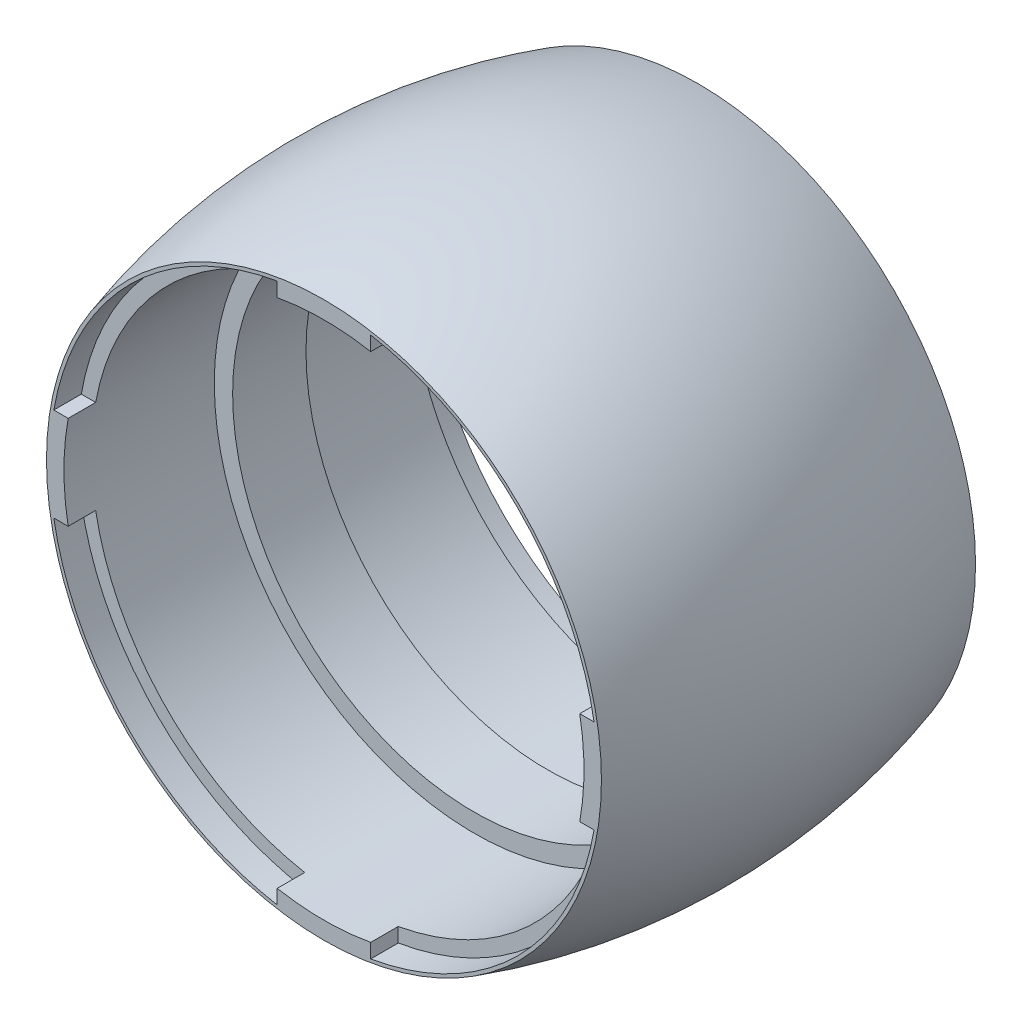
from build123d import *

# Parameters (mm, degrees)
CUT_EXTRUDE1_DEPTH = 3.81
CIRPATTERN1_COUNT  = 2


with BuildPart() as part:
    # Sketch19 → Revolve3 (revolve)
    with BuildSketch(Plane(origin=(0, 0, 0), x_dir=(0, 0, -1), z_dir=(1, 0, 0))):
        with BuildLine():
            ThreePointArc((25.908, 38.433959724), (0, 42.292878264), (-25.908, 38.433959724))
            Line((-25.908, 38.433959724), (-25.908, 36.0172))
            Line((-25.908, 36.0172), (-5.08, 36.0172))
            Line((-5.08, 36.0172), (-5.08, 33.4772))
            Line((-5.08, 33.4772), (5.08, 33.4772))
            Line((5.08, 33.4772), (5.08, 36.0172))
            Line((5.08, 36.0172), (25.908, 36.0172))
            Line((25.908, 36.0172), (25.908, 38.433959724))
        make_face()
    revolve(axis=Axis((0, 0, 51.219231473), (0, 0, -1)))

    # Sketch22 → Cut-Extrude1 (cut)
    with BuildSketch(Plane(origin=(0, 0, -25.908), x_dir=(-1, 0, 0), z_dir=(0, 0, -1))):
        with BuildLine():
            Line((-6.477, 37.416536451), (-6.477, 35.352566413))
            ThreePointArc((-6.477, 35.352566413), (0, 35.941), (6.477, 35.352566413))
            Line((6.477, 35.352566413), (6.477, 37.416536451))
            ThreePointArc((6.477, 37.416536451), (26.850965802, 26.850965802), (37.416536451, 6.477))
            Line((37.416536451, 6.477), (35.352566413, 6.477))
            ThreePointArc((35.352566413, 6.477), (35.941, 0), (35.352566413, -6.477))
            Line((35.352566413, -6.477), (37.416536451, -6.477))
            ThreePointArc((37.416536451, -6.477), (26.850965802, -26.850965802), (6.477, -37.416536451))
            Line((6.477, -37.416536451), (6.477, -35.352566413))
            ThreePointArc((6.477, -35.352566413), (0, -35.941), (-6.477, -35.352566413))
            Line((-6.477, -35.352566413), (-6.477, -37.416536451))
            ThreePointArc((-6.477, -37.416536451), (-26.850965802, -26.850965802), (-37.416536451, -6.477))
            Line((-37.416536451, -6.477), (-35.352566413, -6.477))
            ThreePointArc((-35.352566413, -6.477), (-35.941, 0), (-35.352566413, 6.477))
            Line((-35.352566413, 6.477), (-37.416536451, 6.477))
            ThreePointArc((-37.416536451, 6.477), (-26.850965802, 26.850965802), (-6.477, 37.416536451))
        make_face()
    cut_extrude1 = extrude(amount=-CUT_EXTRUDE1_DEPTH, mode=Mode.SUBTRACT)

    # CirPattern1: Cut-Extrude1 ×2 about axis
    cirpattern1_axis = Axis((0, 46.52216609, 0), (0, -1, 0))
    for i in range(1, CIRPATTERN1_COUNT):
        add(cut_extrude1.rotate(cirpattern1_axis, i * 360 / CIRPATTERN1_COUNT), mode=Mode.SUBTRACT)


solid = part.part
